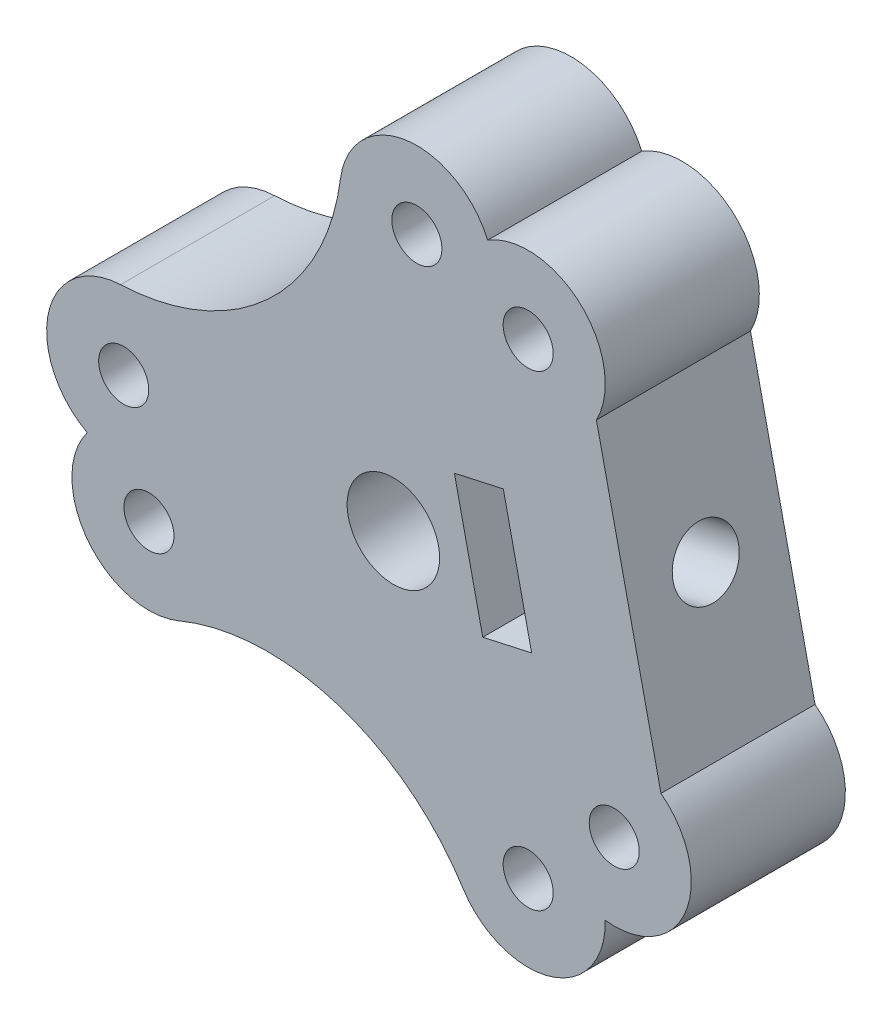
from build123d import *

# Parameters (mm, degrees)
SKETCH1_R                     = 3.048
SKETCH1_R_2                   = 1.651
BOSS_EXTRUDE1_DEPTH           = 10.16
CIRPATTERN1_COUNT             = 2
CIRPATTERN1_ANGLE             = 25
CIRPATTERN2_COUNT             = 3
CIRPATTERN2_COPY_1_SKETCH_R   = 3.048
CIRPATTERN2_COPY_1_SKETCH_R_2 = 1.651
CIRPATTERN2_COPY_1_DEPTH      = 10.16
CIRPATTERN2_COPY_2_SKETCH_R   = 3.048
CIRPATTERN2_COPY_2_SKETCH_R_2 = 1.651
CIRPATTERN2_COPY_2_DEPTH      = 10.16
FILLET1_R                     = 15.24
CUT_EXTRUDE1_DEPTH            = 9.398
BOSS_EXTRUDE3_REACH           = 49.452
SKETCH7_W                     = 10.16
SKETCH7_H                     = 19.663186572
CUT_EXTRUDE3_START            = -1.198457
SKETCH8_W                     = 10.16
SKETCH8_H                     = 19.663186572
CUT_EXTRUDE3_DEPTH            = 1.198457
CUT_EXTRUDE2_REACH            = 49.452
CUT_EXTRUDE2_END_RADIUS       = 3.048
SKETCH5_R                     = 2.159


with BuildPart() as part:
    # Sketch1 → Boss-Extrude1 (new body)
    with BuildSketch(Plane.XY):
        with BuildLine():
            Line((-17.78, 5.08), (0, 5.08))
            ThreePointArc((0, 5.08), (5.08, 0), (0, -5.08))
            Line((0, -5.08), (-17.78, -5.08))
            ThreePointArc((-17.78, -5.08), (-22.86, 0), (-17.78, 5.08))
        make_face()
        Circle(SKETCH1_R, mode=Mode.SUBTRACT)
        with Locations((-17.78, 0)):
            Circle(SKETCH1_R_2, mode=Mode.SUBTRACT)
    boss_extrude1 = extrude(amount=BOSS_EXTRUDE1_DEPTH)

    # CirPattern1: Boss-Extrude1 ×2 about axis
    cirpattern1_axis = Axis((0, 0, 10.16), (0, 0, 1))
    for i in range(1, CIRPATTERN1_COUNT):
        add(boss_extrude1.rotate(cirpattern1_axis, i * CIRPATTERN1_ANGLE / (CIRPATTERN1_COUNT - 1)))

    # CirPattern2: Boss-Extrude1 ×3 about axis
    cirpattern2_axis = Axis((0, 0, 0), (0, 0, 1))
    for i in range(1, CIRPATTERN2_COUNT):
        add(boss_extrude1.rotate(cirpattern2_axis, i * 360 / CIRPATTERN2_COUNT))

    # CirPattern2 copy 1 sketch → CirPattern2 copy 1 (add)
    with BuildSketch(Plane(origin=(0, 0, 0), x_dir=(-0.8191520442889921, 0.5735764363510454, 0), z_dir=(0, 0, 1))):
        with BuildLine():
            Line((-17.78, 5.08), (0, 5.08))
            ThreePointArc((0, 5.08), (5.08, 0), (0, -5.08))
            Line((0, -5.08), (-17.78, -5.08))
            ThreePointArc((-17.78, -5.08), (-22.86, 0), (-17.78, 5.08))
        make_face()
        Circle(CIRPATTERN2_COPY_1_SKETCH_R, mode=Mode.SUBTRACT)
        with Locations((-17.78, 0)):
            Circle(CIRPATTERN2_COPY_1_SKETCH_R_2, mode=Mode.SUBTRACT)
    extrude(amount=CIRPATTERN2_COPY_1_DEPTH)

    # CirPattern2 copy 2 sketch → CirPattern2 copy 2 (add)
    with BuildSketch(Plane(origin=(0, 0, 0), x_dir=(-0.0871557427476577, -0.9961946980917455, 0), z_dir=(0, 0, 1))):
        with BuildLine():
            Line((-17.78, 5.08), (0, 5.08))
            ThreePointArc((0, 5.08), (5.08, 0), (0, -5.08))
            Line((0, -5.08), (-17.78, -5.08))
            ThreePointArc((-17.78, -5.08), (-22.86, 0), (-17.78, 5.08))
        make_face()
        Circle(CIRPATTERN2_COPY_2_SKETCH_R, mode=Mode.SUBTRACT)
        with Locations((-17.78, 0)):
            Circle(CIRPATTERN2_COPY_2_SKETCH_R_2, mode=Mode.SUBTRACT)
    extrude(amount=CIRPATTERN2_COPY_2_DEPTH)

    # Fillet1
    # the kernel refuses this fillet: 15.24 mm, written as the material it adds along each edge
    with BuildSketch(Plane(origin=(-4.654962364, 5.08, 0), x_dir=(0.0874683738412008, 0.9961672969825781, 0), z_dir=(0, 0, 1)), Plane(origin=(6.726890233, 1.491315661, 0), x_dir=(0.81897199868559, -0.5738334822654828, 0), z_dir=(0, 0, 1))) as fillet1_piece_1:
        with BuildLine():
            CenterArc((13.944774221, 15.227642174), FILLET1_R, 187.343482599, 80.348997025)
            Line((-1.17022312, 13.279705988), (-2.681722854, 13.084912369))
            ThreePointArc((-2.681722854, 13.084912369), (-2.666184659, 12.941431463), (-1.518158961, -0.133301802))
            Line((-1.518158961, -0.133301802), (0.000478276, -1.523999925))
            ThreePointArc((0.000478276, -1.523999925), (13.125515266, -1.5198809), (13.269806265, -1.522764217))
            Line((13.269806265, -1.522764217), (13.331166988, 0))
        make_face()
    extrude(amount=10.16)
    with BuildSketch(Plane(origin=(-2.071927869, -6.571315661, 10.16), x_dir=(-0.9064403725267903, -0.4223338147170952, 0), z_dir=(0, 0, -1))) as fillet1_piece_2:
        with BuildLine():
            CenterArc((13.944774221, -15.227642174), FILLET1_R, 92.307520375, 80.348997025)
            Line((-1.17022312, -13.279705988), (-2.681722854, -13.084912369))
            ThreePointArc((-2.681722854, -13.084912369), (-2.666184659, -12.941431463), (-1.518158961, 0.133301802))
            Line((-1.518158961, 0.133301802), (0.000478276, 1.523999925))
            ThreePointArc((0.000478276, 1.523999925), (13.125515266, 1.5198809), (13.269806265, 1.522764217))
            Line((13.269806265, 1.522764217), (13.331166988, 0))
        make_face()
    extrude(amount=10.16)

    # Sketch4 → Cut-Extrude1 (cut)
    with BuildSketch(Plane.XY.offset(10.16)):
        Polygon((4.024997463, 5.315159398), (5.894169969, -3.11613292), (9.117899385, -2.401449315), (7.248726879, 6.029843003), align=None)
    extrude(amount=-CUT_EXTRUDE1_DEPTH, mode=Mode.SUBTRACT)

    # Sketch7 → Boss-Extrude3 (add, up to next)
    with BuildSketch(Plane(origin=(16.68684539, 3.699384559, 0), x_dir=(0, 0, -1), z_dir=(0.9762960071199317, 0.21643961393811023, 0)), mode=Mode.PRIVATE) as boss_extrude3_sk1:
        with Locations((-5.08, 0)):
            Rectangle(SKETCH7_W, SKETCH7_H)
    boss_extrude3_tool1 = extrude(boss_extrude3_sk1.sketch, amount=-BOSS_EXTRUDE3_REACH, mode=Mode.PRIVATE) - part.part
    add(boss_extrude3_tool1.solids().sort_by_distance((16.686845, 3.699385, 5.08))[0])

    # Sketch8 → Cut-Extrude3 (cut)
    with BuildSketch(Plane(origin=(16.68684539, 3.699384559, 0), x_dir=(0, 0, -1), z_dir=(0.9762960071199318, 0.2164396139381102, 0)).offset(CUT_EXTRUDE3_START)):
        with Locations((-5.08, 0)):
            Rectangle(SKETCH8_W, SKETCH8_H)
    extrude(amount=CUT_EXTRUDE3_DEPTH, mode=Mode.SUBTRACT)

    # Cut-Extrude2: up to this cylinder (the profile starts outside it)
    cut_extrude2_end = Plane(origin=(0, 0, 5.08), z_dir=(0, 0, -1)) * Cylinder(CUT_EXTRUDE2_END_RADIUS, 106, mode=Mode.PRIVATE)
    # Sketch5 → Cut-Extrude2 (cut, up to the surface)
    with BuildSketch(Plane(origin=(16.68684539, 3.699384559, 0), x_dir=(0, 0, -1), z_dir=(0.9762960071199317, 0.21643961393811023, 0)), mode=Mode.PRIVATE) as cut_extrude2_sk1:
        with Locations(Location((-5.08, 0, 0), (0, 0, 90))):
            Circle(SKETCH5_R)
    cut_extrude2_tool1 = extrude(cut_extrude2_sk1.sketch, amount=-CUT_EXTRUDE2_REACH, mode=Mode.PRIVATE) - cut_extrude2_end
    add(cut_extrude2_tool1.solids().sort_by_distance((16.686845, 3.699385, 5.08))[0], mode=Mode.SUBTRACT)


solid = part.part
